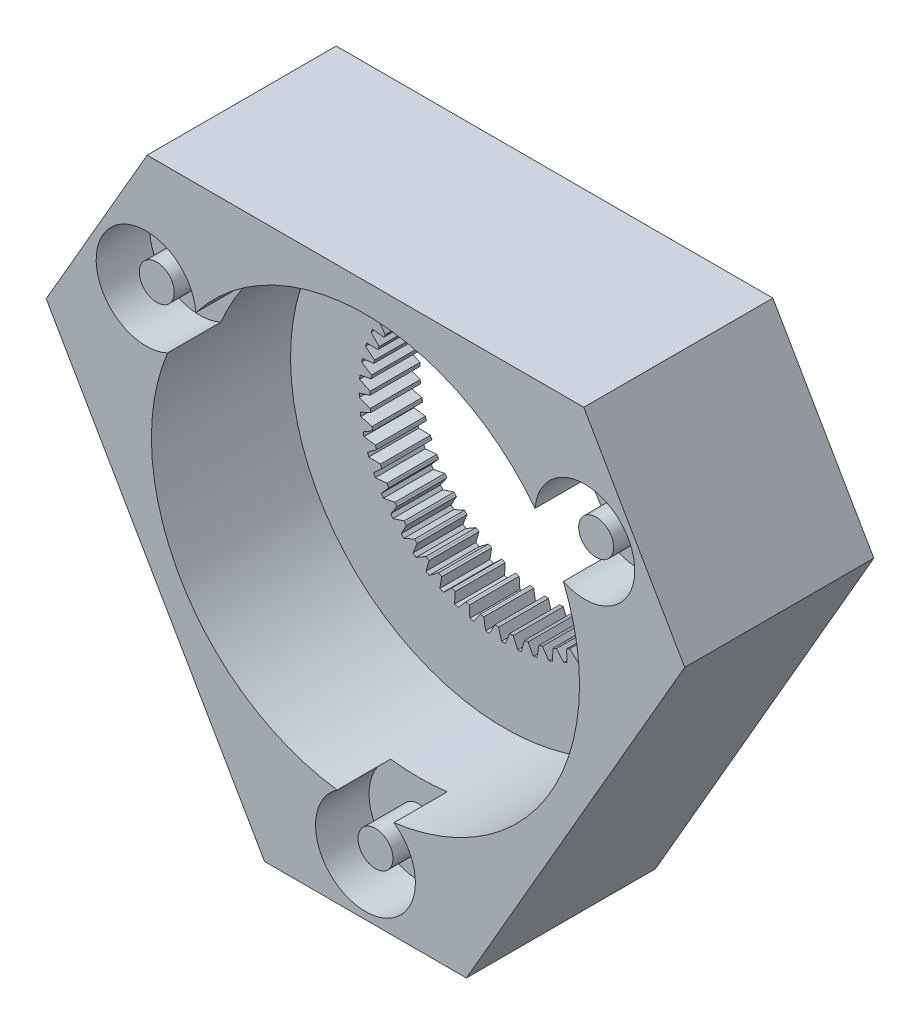
from build123d import *

# Parameters (mm, degrees)
SKETCH1_R                    = 68
SKETCH1_R_2                  = 60
BOSS_EXTRUDE1_DEPTH          = 10
SKETCH2_R                    = 68
SKETCH2_R_2                  = 60
BOSS_EXTRUDE2_DEPTH          = 50
SKETCH3_R                    = 60
BOSS_EXTRUDE3_DEPTH          = 6
CHAMFER1_SIZE                = 50
BOSS_EXTRUDE5_DEPTH          = 2
CHAMFER5_SIZE                = 2
CIRPATTERN2_COUNT            = 3
CIRPATTERN2_ANGLE            = 240
CHAMFER5_OF_CIRPATTERN2_SIZE = 2
SKETCH7_R                    = 60
SKETCH7_R_2                  = 50
BOSS_EXTRUDE6_DEPTH          = 15
CUT_EXTRUDE1_START           = -15
SKETCH8_R                    = 60
SKETCH8_R_2                  = 14
SKETCH8_R_3                  = 13
CUT_EXTRUDE1_DEPTH           = 15
SKETCH9_R                    = 4.9
BOSS_EXTRUDE7_DEPTH          = 12
SKETCH11_W                   = 10
SKETCH11_H                   = 10
CUT_EXTRUDE3_DEPTH           = 198.157508945
SKETCH12_R                   = 50
BOSS_EXTRUDE8_DEPTH          = 15
CUT_EXTRUDE4_DEPTH           = 198.157508945
CUT_EXTRUDE4_DEPTH_BACK      = 198.157508945
CUT_EXTRUDE5_DEPTH           = 7
SKETCH15_R                   = 50
CUT_EXTRUDE6_DEPTH           = 5


with BuildPart() as part:
    # Sketch1 → Boss-Extrude1 (new body)
    # profile 1 of 13: a face of its own
    with BuildSketch(Plane.XY):
        Polygon((69.570707437, 17.5), (108.830525742, 17.5), (128.460434895, 51.5), (108.830525742, 85.5), (69.570707437, 85.5), (49.940798285, 51.5), align=None)
    # profile 2 of 13: a face of its own
    with BuildSketch(Plane.XY):
        Polygon((78.51963661, 0), (39.259818305, 68), (69.570707437, 85.5), (49.940798285, 51.5), (69.570707437, 17.5), (108.830525742, 17.5), align=None)
    # profile 3 of 13: a face of its own
    with BuildSketch(Plane.XY):
        with BuildLine():
            ThreePointArc((-4.61e-07, 68), (33.999999641, 58.889727665), (58.889727273, 34.000000319))
            Line((58.889727273, 34.000000319), (39.259818305, 68))
            Line((39.259818305, 68), (-4.61e-07, 68))
        make_face()
    # profile 4 of 13: a face of its own
    with BuildSketch(Plane.XY):
        Circle(SKETCH1_R)
        Circle(SKETCH1_R_2, mode=Mode.SUBTRACT)
    # profile 5 of 13: a face of its own
    with BuildSketch(Plane.XY):
        Polygon((-49.940798285, 51.5), (-69.570707437, 85.5), (-108.830525742, 85.5), (-128.460434895, 51.5), (-108.830525742, 17.5), (-69.570707437, 17.5), align=None)
    # profile 6 of 13: a face of its own
    with BuildSketch(Plane.XY):
        Polygon((-39.259818305, 68), (-78.51963661, 0), (-108.830525742, 17.5), (-69.570707437, 17.5), (-49.940798285, 51.5), (-69.570707437, 85.5), align=None)
    # profile 7 of 13: a face of its own
    with BuildSketch(Plane.XY):
        with BuildLine():
            Line((-39.259818305, 68), (-58.889727568, 33.999999808))
            ThreePointArc((-58.889727568, 33.999999808), (-34.000000295, 58.889727287), (-4.61e-07, 68))
            Line((-4.61e-07, 68), (-39.259818305, 68))
        make_face()
    # profile 8 of 13: a face of its own
    with BuildSketch(Plane.XY):
        with BuildLine():
            Line((-78.51963661, 0), (-58.88972767, -33.999999631))
            ThreePointArc((-58.88972767, -33.999999631), (-68, 1.02e-07), (-58.889727568, 33.999999808))
            Line((-58.889727568, 33.999999808), (-78.51963661, 0))
        make_face()
    # profile 9 of 13: a face of its own
    with BuildSketch(Plane.XY):
        with BuildLine():
            ThreePointArc((68, 0), (65.682956216, -17.59969496), (58.889727568, -33.999999808))
            Line((58.889727568, -33.999999808), (78.51963661, 0))
            Line((78.51963661, 0), (58.889727273, 34.000000319))
            ThreePointArc((58.889727273, 34.000000319), (65.68295614, 17.599695245), (68, 0))
        make_face()
    # profile 10 of 13: a face of its own
    with BuildSketch(Plane.XY):
        with BuildLine():
            Line((0, -68), (39.259818305, -68))
            Line((39.259818305, -68), (58.889727568, -33.999999808))
            ThreePointArc((58.889727568, -33.999999808), (34.000000096, -58.889727402), (0, -68))
        make_face()
    # profile 11 of 13: a face of its own
    with BuildSketch(Plane.XY):
        Polygon((-39.259818305, -68), (39.259818305, -68), (39.259818305, -103), (19.629909152, -69), (-19.629909152, -69), (-39.259818305, -103), align=None)
    # profile 12 of 13: a face of its own
    with BuildSketch(Plane.XY):
        Polygon((-19.629909152, -69), (-39.259818305, -103), (-19.629909152, -137), (19.629909152, -137), (39.259818305, -103), (19.629909152, -69), align=None)
    # profile 13 of 13: a face of its own
    with BuildSketch(Plane.XY):
        with BuildLine():
            Line((-39.259818305, -68), (0, -68))
            ThreePointArc((0, -68), (-34.000000184, -58.889727351), (-58.88972767, -33.999999631))
            Line((-58.88972767, -33.999999631), (-39.259818305, -68))
        make_face()
    extrude(amount=BOSS_EXTRUDE1_DEPTH)

    # Sketch2 → Boss-Extrude2 (add)
    # profile 1 of 4: a face of its own
    with BuildSketch(Plane.XY.offset(10)):
        with BuildLine():
            Line((39.259818305, 68), (-4.61e-07, 68))
            ThreePointArc((-4.61e-07, 68), (48.083260958, 48.083261284), (68, 0))
            ThreePointArc((68, 0), (65.682956216, -17.59969496), (58.889727568, -33.999999808))
            Line((58.889727568, -33.999999808), (78.51963661, 0))
            Line((78.51963661, 0), (108.830525742, 17.5))
            Line((108.830525742, 17.5), (128.460434895, 51.5))
            Line((128.460434895, 51.5), (108.830525742, 85.5))
            Line((108.830525742, 85.5), (69.570707437, 85.5))
            Line((69.570707437, 85.5), (39.259818305, 68))
        make_face()
    # profile 2 of 4: a face of its own
    with BuildSketch(Plane.XY.offset(10)):
        Circle(SKETCH2_R)
        Circle(SKETCH2_R_2, mode=Mode.SUBTRACT)
    # profile 3 of 4: a face of its own
    with BuildSketch(Plane.XY.offset(10)):
        with BuildLine():
            Line((-58.889727551, -33.999999837), (-39.259818305, -68))
            Line((-39.259818305, -68), (-39.259818305, -103))
            Line((-39.259818305, -103), (-19.629909152, -137))
            Line((-19.629909152, -137), (19.629909152, -137))
            Line((19.629909152, -137), (39.259818305, -103))
            Line((39.259818305, -103), (39.259818305, -68))
            Line((39.259818305, -68), (58.889727568, -33.999999808))
            ThreePointArc((58.889727568, -33.999999808), (1.6e-08, -68), (-58.889727551, -33.999999837))
        make_face()
    # profile 4 of 4: a face of its own
    with BuildSketch(Plane.XY.offset(10)):
        with BuildLine():
            Line((-78.51963661, 0), (-58.889727551, -33.999999837))
            ThreePointArc((-58.889727551, -33.999999837), (-58.889727525, 33.999999882), (-4.61e-07, 68))
            Line((-4.61e-07, 68), (-39.259818305, 68))
            Line((-39.259818305, 68), (-69.570707437, 85.5))
            Line((-69.570707437, 85.5), (-108.830525742, 85.5))
            Line((-108.830525742, 85.5), (-128.460434895, 51.5))
            Line((-128.460434895, 51.5), (-108.830525742, 17.5))
            Line((-108.830525742, 17.5), (-78.51963661, 0))
        make_face()
    extrude(amount=BOSS_EXTRUDE2_DEPTH)

    # Sketch3 → Boss-Extrude3 (add)
    with BuildSketch(Plane(origin=(0, 0, 0), x_dir=(-1, 0, 0), z_dir=(0, 0, -1))):
        Circle(SKETCH3_R)
    extrude(amount=-BOSS_EXTRUDE3_DEPTH)

    # Chamfer1
    chamfer1_edges = [part.edges().sort_by_distance(p)[0] for p in [
        (0, -137, 60),
        (118.645480318, 68.5, 60),
        (-118.645480318, 68.5, 60),
    ]]
    chamfer(chamfer1_edges, length=CHAMFER1_SIZE)

    # Sketch6 → Boss-Extrude5 (add)
    with BuildSketch(Plane(origin=(-63.652867178, 36.75, 73.5), x_dir=(0.7905694150420939, 0.2738612787525844, 0.5477225575051671), z_dir=(-0.612372435695796, 0.35355339059327434, 0.707106781186546))):
        Polygon((-53.378963463, 43.583741161), (-57.022592695, 21.16544633), (-39.429594478, 6.800823438), (-18.192967029, 14.854495376), (-14.549337797, 37.272790207), (-32.142336014, 51.637413099), align=None)
        Polygon((-37.996747262, 43.224111766), (-41.317138805, 39.157479253), (-35.081635618, 34.06621222), (-40.394262087, 27.559600198), (-46.629765274, 32.650867231), (-49.950156817, 28.584234718), (-33.57518323, 15.21412477), (-30.254791686, 19.280757284), (-36.490294874, 24.372024317), (-31.177668405, 30.878636338), (-24.942165217, 25.787369306), (-21.621773674, 29.854001819), align=None, mode=Mode.SUBTRACT)
    boss_extrude5 = extrude(amount=BOSS_EXTRUDE5_DEPTH)

    # Chamfer5
    chamfer5_edges = [part.edges().sort_by_distance(p)[0] for p in [
        (-77.820144436, 56.285712856, 54.291348689),
        (-87.654929421, 39.25136558, 54.291348689),
        (-103.003686646, 36.756743178, 42.246246217),
        (-108.517658885, 51.296468052, 30.201143745),
        (-98.6828739, 68.330815328, 30.201143745),
        (-83.334116675, 70.82543773, 42.246246217),
    ]]
    chamfer(chamfer5_edges, length=CHAMFER5_SIZE - 0.0001)  # a hair under: the kernel refuses the full size

    # CirPattern2: Boss-Extrude5 ×3 about axis
    cirpattern2_axis = Axis((0, 0, 0), (0, 0, 1))
    for i in range(1, CIRPATTERN2_COUNT):
        add(boss_extrude5.rotate(cirpattern2_axis, i * CIRPATTERN2_ANGLE / (CIRPATTERN2_COUNT - 1)))

    # Chamfer5 of CirPattern2
    chamfer5_of_cirpattern2_edges = [part.edges().sort_by_distance(p)[0] for p in [
        (-9.834784985, -95.537078436, 54.291348689),
        (9.834784985, -95.537078436, 54.291348689),
        (19.669569971, -107.582180908, 42.246246217),
        (9.834784985, -119.62728338, 30.201143745),
        (-9.834784985, -119.62728338, 30.201143745),
        (-19.669569971, -107.582180908, 42.246246217),
        (87.654929421, 39.25136558, 54.291348689),
        (77.820144436, 56.285712856, 54.291348689),
        (83.334116675, 70.82543773, 42.246246217),
        (98.6828739, 68.330815328, 30.201143745),
        (108.517658885, 51.296468052, 30.201143745),
        (103.003686646, 36.756743178, 42.246246217),
    ]]
    chamfer(chamfer5_of_cirpattern2_edges, length=CHAMFER5_OF_CIRPATTERN2_SIZE - 0.0001)  # a hair under: the kernel refuses the full size

    # Sketch7 → Boss-Extrude6 (add)
    with BuildSketch(Plane.XY.offset(6)):
        Circle(SKETCH7_R)
        Circle(SKETCH7_R_2, mode=Mode.SUBTRACT)
    extrude(amount=BOSS_EXTRUDE6_DEPTH)

    # Sketch8 → Cut-Extrude1 (cut)
    # profile 1 of 12: a face of its own
    with BuildSketch(Plane.XY.offset(60).offset(CUT_EXTRUDE1_START)):
        with Locations(Location((0, 0, 0), (0, 0, 157.607948507))):
            Circle(SKETCH8_R)
    # profile 2 of 12: a face of its own
    with BuildSketch(Plane.XY.offset(60).offset(CUT_EXTRUDE1_START)):
        with Locations((-61.487803669, 35.5)):
            Circle(SKETCH8_R_2)
        with Locations((-61.487803669, 35.5)):
            Circle(SKETCH8_R_3, mode=Mode.SUBTRACT)
    # profile 3 of 12: a face of its own
    with BuildSketch(Plane.XY.offset(60).offset(CUT_EXTRUDE1_START)):
        with Locations((-61.487803669, 35.5)):
            Circle(SKETCH8_R_3)
    # profile 4 of 12: a face of its own
    with BuildSketch(Plane.XY.offset(60).offset(CUT_EXTRUDE1_START)):
        with Locations(Location((0, 0, 0), (0, 0, 157.607948507))):
            Circle(SKETCH8_R)
    # profile 5 of 12: a face of its own
    with BuildSketch(Plane.XY.offset(60).offset(CUT_EXTRUDE1_START)):
        with Locations(Location((0, 0, 0), (0, 0, 157.607948507))):
            Circle(SKETCH8_R)
    # profile 6 of 12: a face of its own
    with BuildSketch(Plane.XY.offset(60).offset(CUT_EXTRUDE1_START)):
        with Locations((61.487803669, 35.5)):
            Circle(SKETCH8_R_2)
        with Locations((61.487803669, 35.5)):
            Circle(SKETCH8_R_3, mode=Mode.SUBTRACT)
    # profile 7 of 12: a face of its own
    with BuildSketch(Plane.XY.offset(60).offset(CUT_EXTRUDE1_START)):
        with Locations((61.487803669, 35.5)):
            Circle(SKETCH8_R_3)
    # profile 8 of 12: a face of its own
    with BuildSketch(Plane.XY.offset(60).offset(CUT_EXTRUDE1_START)):
        with Locations(Location((0, 0, 0), (0, 0, 157.607948507))):
            Circle(SKETCH8_R)
    # profile 9 of 12: a face of its own
    with BuildSketch(Plane.XY.offset(60).offset(CUT_EXTRUDE1_START)):
        with Locations(Location((0, 0, 0), (0, 0, 157.607948507))):
            Circle(SKETCH8_R)
    # profile 10 of 12: a face of its own
    with BuildSketch(Plane.XY.offset(60).offset(CUT_EXTRUDE1_START)):
        with Locations((0, -71)):
            Circle(SKETCH8_R_2)
        with Locations((0, -71)):
            Circle(SKETCH8_R_3, mode=Mode.SUBTRACT)
    # profile 11 of 12: a face of its own
    with BuildSketch(Plane.XY.offset(60).offset(CUT_EXTRUDE1_START)):
        with Locations((0, -71)):
            Circle(SKETCH8_R_3)
    # profile 12 of 12: a face of its own
    with BuildSketch(Plane.XY.offset(60).offset(CUT_EXTRUDE1_START)):
        with Locations(Location((0, 0, 0), (0, 0, 157.607948507))):
            Circle(SKETCH8_R)
    extrude(amount=CUT_EXTRUDE1_DEPTH, mode=Mode.SUBTRACT)

    # Sketch9 → Boss-Extrude7 (add)
    with BuildSketch(Plane.XY.offset(45)):
        with Locations((-61.487803669, 35.5)):
            Circle(SKETCH9_R)
        with Locations((61.667072878, 35.187670037)):
            Circle(SKETCH9_R)
        with Locations((-0.180851078, -71.311416671)):
            Circle(SKETCH9_R)
    extrude(amount=BOSS_EXTRUDE7_DEPTH)

    # Sketch11 → Cut-Extrude3 (cut, through all)
    with BuildSketch(Plane(origin=(0, 0, 0), x_dir=(-1, 0, 0), z_dir=(0, 0, -1))):
        with BuildLine():
            ThreePointArc((5, -34.641016151), (24.748737342, -24.748737342), (34.641016151, -5))
            Line((34.641016151, -5), (14.142135624, -5))
            ThreePointArc((14.142135624, -5), (10.606601718, -10.606601718), (5, -14.142135624))
            Line((5, -14.142135624), (5, -34.641016151))
        make_face()
        with BuildLine():
            Line((14.142135624, 5), (34.641016151, 5))
            ThreePointArc((34.641016151, 5), (24.748737342, 24.748737342), (5, 34.641016151))
            Line((5, 34.641016151), (5, 14.142135624))
            ThreePointArc((5, 14.142135624), (10.606601718, 10.606601718), (14.142135624, 5))
        make_face()
        with BuildLine():
            ThreePointArc((-34.641016151, -5), (-24.748737342, -24.748737342), (-5, -34.641016151))
            Line((-5, -34.641016151), (-5, -14.142135624))
            ThreePointArc((-5, -14.142135624), (-10.606601718, -10.606601718), (-14.142135624, -5))
            Line((-14.142135624, -5), (-34.641016151, -5))
        make_face()
        with BuildLine():
            Line((-5, 14.142135624), (-5, 34.641016151))
            ThreePointArc((-5, 34.641016151), (-24.748737342, 24.748737342), (-34.641016151, 5))
            Line((-34.641016151, 5), (-14.142135624, 5))
            ThreePointArc((-14.142135624, 5), (-10.606601718, 10.606601718), (-5, 14.142135624))
        make_face()
        with BuildLine():
            Line((5, 5), (14.142135624, 5))
            ThreePointArc((14.142135624, 5), (10.606601718, 10.606601718), (5, 14.142135624))
            Line((5, 14.142135624), (5, 5))
        make_face()
        with BuildLine():
            ThreePointArc((35, 0), (34.91013868, 2.506435188), (34.641016151, 5))
            Line((34.641016151, 5), (14.142135624, 5))
            ThreePointArc((14.142135624, 5), (14.783978395, 2.536529681), (15, 0))
            ThreePointArc((15, 0), (14.783978395, -2.536529681), (14.142135624, -5))
            Line((14.142135624, -5), (34.641016151, -5))
            ThreePointArc((34.641016151, -5), (34.91013868, -2.506435188), (35, 0))
        make_face()
        with BuildLine():
            Line((-14.142135624, 5), (-34.641016151, 5))
            ThreePointArc((-34.641016151, 5), (-35, 0), (-34.641016151, -5))
            Line((-34.641016151, -5), (-14.142135624, -5))
            ThreePointArc((-14.142135624, -5), (-15, 0), (-14.142135624, 5))
        make_face()
        with BuildLine():
            ThreePointArc((15, 0), (14.783978395, 2.536529681), (14.142135624, 5))
            Line((14.142135624, 5), (5, 5))
            Line((5, 5), (5, -5))
            Line((5, -5), (14.142135624, -5))
            ThreePointArc((14.142135624, -5), (14.783978395, -2.536529681), (15, 0))
        make_face()
        with BuildLine():
            ThreePointArc((5, -14.142135624), (10.606601718, -10.606601718), (14.142135624, -5))
            Line((14.142135624, -5), (5, -5))
            Line((5, -5), (5, -14.142135624))
        make_face()
        with BuildLine():
            Line((5, 14.142135624), (5, 34.641016151))
            ThreePointArc((5, 34.641016151), (0, 35), (-5, 34.641016151))
            Line((-5, 34.641016151), (-5, 14.142135624))
            ThreePointArc((-5, 14.142135624), (0, 15), (5, 14.142135624))
        make_face()
        with BuildLine():
            ThreePointArc((-5, -34.641016151), (0, -35), (5, -34.641016151))
            Line((5, -34.641016151), (5, -14.142135624))
            ThreePointArc((5, -14.142135624), (0, -15), (-5, -14.142135624))
            Line((-5, -14.142135624), (-5, -34.641016151))
        make_face()
        with BuildLine():
            Line((5, -14.142135624), (5, -5))
            Line((5, -5), (-5, -5))
            Line((-5, -5), (-5, -14.142135624))
            ThreePointArc((-5, -14.142135624), (0, -15), (5, -14.142135624))
        make_face()
        Rectangle(SKETCH11_W, SKETCH11_H)
        with BuildLine():
            Line((-5, -14.142135624), (-5, -5))
            Line((-5, -5), (-14.142135624, -5))
            ThreePointArc((-14.142135624, -5), (-10.606601718, -10.606601718), (-5, -14.142135624))
        make_face()
        with BuildLine():
            Line((-5, -5), (-5, 5))
            Line((-5, 5), (-14.142135624, 5))
            ThreePointArc((-14.142135624, 5), (-15, 0), (-14.142135624, -5))
            Line((-14.142135624, -5), (-5, -5))
        make_face()
        with BuildLine():
            Line((-14.142135624, 5), (-5, 5))
            Line((-5, 5), (-5, 14.142135624))
            ThreePointArc((-5, 14.142135624), (-10.606601718, 10.606601718), (-14.142135624, 5))
        make_face()
        with BuildLine():
            Line((-5, 5), (5, 5))
            Line((5, 5), (5, 14.142135624))
            ThreePointArc((5, 14.142135624), (0, 15), (-5, 14.142135624))
            Line((-5, 14.142135624), (-5, 5))
        make_face()
    extrude(amount=-CUT_EXTRUDE3_DEPTH, mode=Mode.SUBTRACT)

    # Sketch12 → Boss-Extrude8 (add)
    with BuildSketch(Plane.XY.offset(6)):
        Circle(SKETCH12_R)
        Polygon((0, 39), (-0.5, 39), (-1.532335319, 41.972037697), (-2.592335319, 41.91992125), (-3.64827854, 38.832203951), (-4.14544594, 38.779057208), (-4.642411279, 38.724053098), (-5.995429602, 41.564487167), (-7.043262882, 41.396078317), (-7.753122956, 38.210938936), (-8.241426308, 38.103422256), (-8.729324499, 37.994081711), (-10.386602016, 40.668433131), (-11.4095493, 40.385776133), (-11.764709487, 37.141877947), (-12.23822145, 36.981296438), (-12.711130071, 36.818946703), (-14.652549678, 39.29475247), (-15.638193771, 38.901278398), (-15.634342908, 35.637997936), (-16.087315688, 35.426300839), (-16.539494268, 35.212912622), (-18.741489761, 37.460119807), (-19.67786628, 36.960604903), (-19.31505111, 33.71755397), (-19.741986231, 33.457311001), (-20.167945935, 33.195474544), (-22.603788072, 35.186805098), (-23.479530673, 34.587312796), (-22.762155282, 31.403857636), (-23.15787033, 31.098227794), (-23.552440585, 30.791121437), (-26.192561541, 32.502403303), (-26.997039896, 31.810210627), (-25.933812249, 28.724994075), (-26.293503779, 28.37768729), (-26.651895036, 28.02903889), (-29.46424732, 29.439499424), (-30.187696152, 28.663008656), (-28.791522392, 25.713481061), (-29.110824237, 25.328713167), (-29.428686111, 24.942754842), (-32.379131575, 26.035272964), (-33.012769195, 25.183909651), (-31.300596981, 22.405874282), (-31.575633248, 21.988315841), (-31.849107327, 21.569732602), (-34.901831561, 22.331046622), (-35.437966466, 21.41514516), (-33.430579248, 18.842323604), (-33.658011371, 18.397043209), (-33.88377805, 17.95091609), (-37.001725116, 18.371784688), (-37.433849355, 17.40246288), (-35.155614096, 15.066085704), (-35.332681355, 14.598488457), (-35.508000133, 14.130232837), (-38.653322378, 14.205547237), (-38.976190548, 13.194571338), (-36.454761937, 11.122998997), (-36.579314977, 10.638760894), (-36.70205772, 10.154060761), (-39.836575193, 9.88290675), (-40.046268112, 8.842548636), (-37.312252877, 7.060927212), (-37.382779792, 6.565926248), (-37.451456571, 6.070665206), (-40.537120475, 5.456334225), (-40.631092754, 4.399222436), (-37.717678137, 2.929178399), (-37.733322826, 2.429423215), (-37.747099997, 1.929613062), (-40.746454553, 0.979562257), (-40.723565497, -0.081471303), (-37.666116404, -1.222093609), (-37.626688961, -1.720536662), (-37.585399288, -2.218828908), (-40.462036395, -3.493067207), (-40.322563845, -4.545143027), (-37.158193567, -5.342497993), (-37.064172588, -5.833578491), (-36.968317272, -6.324304238), (-39.687318452, -7.907262504), (-39.432955417, -8.937609809), (-36.200075121, -9.382018626), (-36.052601895, -9.859775517), (-35.903344489, -10.336978018), (-38.431704751, -12.209441282), (-38.065538853, -13.205553053), (-34.803391327, -13.291621198), (-34.604255978, -13.750255162), (-34.403408265, -14.208141825), (-36.71043674, -16.34738092), (-36.236912737, -17.297165707), (-32.985096034, -17.023848432), (-32.736715795, -17.457792272), (-32.486715795, -17.890804974), (-34.544408282, -20.270852435), (-33.969274115, -21.162781139), (-30.767260884, -20.533396144), (-30.472650754, -20.937382371), (-30.176533128, -21.340264924), (-31.959912028, -23.932230198), (-31.290149046, -24.755476012), (-28.17680739, -23.777663179), (-27.839543538, -24.146787947), (-27.500902753, -24.514649902), (-28.988320262, -27.287070043), (-28.23205848, -28.031639879), (-25.24518015, -26.71726853), (-24.869356502, -27.047051164), (-24.492303197, -27.375427176), (-25.665704083, -30.294648759), (-24.832123494, -30.951504547), (-22.007965146, -29.31652937), (-21.598143692, -29.602966756), (-21.187254785, -29.887870785), (-22.032395549, -32.918458414), (-21.131614693, -33.479626814), (-18.504457784, -31.543894194), (-18.065613201, -31.78350937), (-17.625876326, -32.021483067), (-18.132498104, -35.126649513), (-17.17545124, -35.585318702), (-14.777185896, -33.37232581), (-14.314645164, -33.562210173), (-13.851398131, -33.750364859), (-14.013351221, -36.892417608), (-13.011655602, -37.243019963), (-10.871393515, -34.779629535), (-10.390771251, -34.917478145), (-9.909637251, -35.053529877), (-9.724955763, -38.194328667), (-8.690770617, -38.43260835), (-6.83449167, -35.748722608), (-6.341621977, -35.83286217), (-5.848441325, -35.915159465), (-5.319367041, -39.016579251), (-4.265245974, -39.13964387), (-2.715482879, -36.267841552), (-2.216348528, -36.297250726), (-1.71710777, -36.324794606), (-0.850062935, -39.349188354), (0.211198451, -39.35554407), (1.43563367, -36.330684967), (1.934973865, -36.305006765), (2.434214623, -36.277462885), (3.628705258, -39.188118551), (4.684224687, -39.077688215), (5.568469045, -35.936490018), (6.06195377, -35.856036139), (6.555134421, -35.773738843), (8.06257136, -38.535325011), (9.099536256, -38.309449099), (9.632856224, -35.090041697), (10.114495242, -34.955788742), (10.595629242, -34.81973701), (12.397714241, -37.398731765), (13.403537255, -37.060152102), (13.579459051, -33.801614742), (14.043405918, -33.61519236), (14.506652952, -33.427037674), (16.58151114, -35.792135513), (17.543982944, -35.344961999), (17.360371115, -32.08684891), (17.800994145, -31.850520016), (18.24073102, -31.61254632), (20.56317643, -33.735038158), (21.470613919, -33.184698874), (20.929697266, -29.966559135), (21.34164789, -29.683192442), (21.752536798, -29.398288413), (24.294378088, -31.252410076), (25.135766201, -30.605585395), (24.244110718, -27.466482863), (24.622388415, -27.139518059), (24.99944172, -26.811142047), (27.729824381, -28.374387008), (28.494949805, -27.638928505), (27.263378982, -24.616967634), (27.603391974, -24.250373627), (27.942032759, -23.882511672), (30.827813644, -25.135904256), (31.507388794, -24.320739401), (29.950852232, -21.452602701), (30.24847322, -21.050829447), (30.544590847, -20.647946894), (33.550740485, -21.576272613), (34.136516237, -20.691296404), (32.273908182, -18.011799168), (32.525524452, -17.579723651), (32.775524452, -17.146710949), (35.865552259, -17.738701186), (36.350418091, -16.794656034), (34.204348081, -14.336323731), (34.406905352, -13.879190761), (34.607753064, -13.421304098), (37.744150288, -13.669772893), (38.122220585, -12.678118228), (35.718739003, -10.47079168), (35.869778504, -9.994150233), (36.019035909, -9.516947732), (39.163730936, -9.418879011), (39.430416437, -8.391652178), (36.798698294, -6.46212534), (36.896386609, -5.971761197), (36.992241925, -5.48103545), (40.107062418, -5.037619635), (40.259125922, -3.987289775), (37.431116711, -2.358984489), (37.474268037, -1.860850007), (37.51555771, -1.36255776), (40.562693967, -0.579177317), (40.59828963, 0.481505988), (37.608317551, 1.788824301), (37.59640809, 2.288682445), (37.582630918, 2.788492599), (40.525094833, 3.902328492), (40.443790571, 4.960489983), (37.328149836, 5.93095225), (37.261324151, 6.426466455), (37.192647373, 6.921727498), (39.994721419, 8.352498382), (39.797504156, 9.395293412), (36.594014422, 10.017119536), (36.473083688, 10.502274931), (36.350340945, 10.986975064), (38.97801174, 12.717313319), (38.667275426, 13.73208377), (35.414822719, 13.997725624), (35.241254871, 14.466633079), (35.065936093, 14.9348887), (37.487307274, 16.943790363), (37.066823826, 17.918218295), (33.804888517, 17.824451347), (33.580790433, 18.271418962), (33.355023754, 18.717546081), (35.540703153, 20.980625808), (35.015576672, 21.902882986), (31.783754236, 21.45084544), (31.511846163, 21.870447632), (31.238372084, 22.289030871), (33.161828515, 24.77881794), (32.538433325, 25.637709412), (29.375953708, 24.83288839), (29.059536243, 25.220031758), (28.741674369, 25.605990083), (30.379559676, 28.29226185), (29.665462949, 29.077361837), (26.610714371, 27.929526777), (26.253628392, 28.279511925), (25.895237135, 28.628160325), (27.22766961, 31.478309091), (26.431539514, 32.180087542), (23.521602483, 30.703171607), (23.128182531, 31.011750189), (22.733612276, 31.318856545), (23.744417993, 34.298285364), (22.875918468, 34.90822364), (20.146115679, 33.120154588), (19.721137338, 33.383580878), (19.295177634, 33.645417335), (19.97208678, 36.717959978), (19.041760235, 37.228654253), (16.525227795, 35.151136821), (16.073849728, 35.36621318), (15.621671148, 35.579601398), (15.956466964, 38.707961359), (14.975606302, 39.113212498), (12.702891506, 36.771464933), (12.23059283, 36.935580626), (11.75768421, 37.097930361), (11.746302728, 40.244133588), (10.726814269, 40.539022391), (8.725504797, 37.961470336), (8.238018578, 38.072633221), (7.750120387, 38.181973766), (7.392699764, 41.307829615), (6.346958716, 41.48877653), (4.641347753, 38.706707975), (4.144591415, 38.763568686), (3.647626076, 38.818572796), (2.948504913, 41.88613761), (1.889205157, 41.950946188), (0.499996509, 38.998131677), align=None, mode=Mode.SUBTRACT)
    extrude(amount=BOSS_EXTRUDE8_DEPTH)

    # Sketch13 → Cut-Extrude4 (cut, two sides: drawn at the far end of the back side and taken through both)
    with BuildSketch(Plane.XY.offset(60).offset(-CUT_EXTRUDE4_DEPTH_BACK)):
        Polygon((94.974119282, 9.5), (108.830525742, 17.5), (128.460434895, 51.5), (108.830525742, 85.5), (69.570707437, 85.5), (55.714300977, 77.5), align=None)
        Polygon((-39.259818305, -87), (-39.259818305, -103), (-19.629909152, -137), (19.629909152, -137), (39.259818305, -103), (39.259818305, -87), align=None)
        Polygon((39.259818305, -68), (28.29016319, -87), (39.259818305, -87), align=None)
        Polygon((-39.259818305, -87), (-28.29016319, -87), (-39.259818305, -68), align=None)
        Polygon((-94.974119282, 9.5), (-78.51963661, 0), (-89.489291724, 19), align=None)
        Polygon((-55.714300977, 77.5), (-69.570707437, 85.5), (-108.830525742, 85.5), (-128.460434895, 51.5), (-108.830525742, 17.5), (-94.974119282, 9.5), align=None)
        Polygon((-55.714300977, 77.5), (-61.199128534, 68), (-39.259818305, 68), align=None)
        Polygon((39.259818305, 68), (61.199128534, 68), (55.714300977, 77.5), align=None)
        Polygon((89.489291724, 19), (78.51963661, 0), (94.974119282, 9.5), align=None)
    extrude(amount=CUT_EXTRUDE4_DEPTH + CUT_EXTRUDE4_DEPTH_BACK, mode=Mode.SUBTRACT)

    # Sketch14 → Cut-Extrude5 (cut)
    with BuildSketch(Plane(origin=(0, 0, 0), x_dir=(-1, 0, 0), z_dir=(0, 0, -1))):
        Polygon((-89.489291724, 19), (-28.29016319, -87), (28.29016319, -87), (89.489291724, 19), (61.199128534, 68), (-61.199128534, 68), align=None)
    extrude(amount=-CUT_EXTRUDE5_DEPTH, mode=Mode.SUBTRACT)

    # Sketch15 → Cut-Extrude6 (cut)
    with BuildSketch(Plane(origin=(0, 0, 7), x_dir=(-1, 0, 0), z_dir=(0, 0, -1))):
        Polygon((-58.312377188, 63), (-83.715789032, 19), (-25.403411844, -82), (25.403411844, -82), (83.715789032, 19), (58.312377188, 63), align=None)
        Circle(SKETCH15_R, mode=Mode.SUBTRACT)
    extrude(amount=-CUT_EXTRUDE6_DEPTH, mode=Mode.SUBTRACT)


solid = part.part
